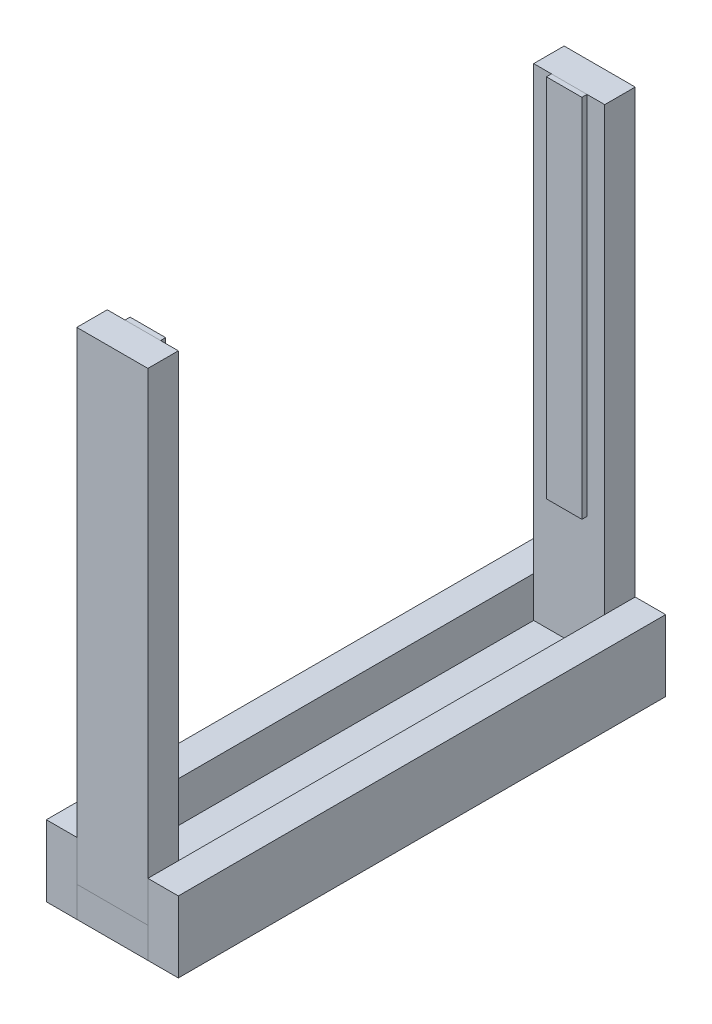
from build123d import *

# Parameters (mm, degrees)
SKETCH1_W             = 88.9
SKETCH1_H             = 609.6
BASE_BOARD_DEPTH      = 38.1
SKETCH2_W             = 88.9
SKETCH2_H             = 38.1
VERTICAL_BOARD_DEPTH  = 603.25
SKETCH3_W             = 609.6
SKETCH3_H             = 88.9
LATERAL_SUPPORT_DEPTH = 38.1
SKETCH4_W             = 44.45
SKETCH4_H             = 457.2
DRAWER_SLIDE_DEPTH    = 6.35


with BuildPart() as part:
    # Sketch1 → Base Board (new body)
    with BuildSketch(Plane(origin=(0, 0, 0), x_dir=(1, 0, 0), z_dir=(0, 1, 0))):
        Rectangle(SKETCH1_W, SKETCH1_H)
    extrude(amount=BASE_BOARD_DEPTH)


with BuildPart() as body_2:
    # Sketch2 → Vertical Board (new body)
    with BuildSketch(Plane(origin=(0, 38.1, 0), x_dir=(1, 0, 0), z_dir=(0, 1, 0))):
        with Locations((0, -285.75)):
            Rectangle(SKETCH2_W, SKETCH2_H)
    extrude(amount=VERTICAL_BOARD_DEPTH)


with BuildPart() as body_3:
    # Vertical Board Mirror: mirrored copy
    add(body_2.part.mirror(Plane.XY))


with BuildPart() as body_4:
    # Sketch3 → Lateral Support (new body)
    with BuildSketch(Plane(origin=(44.45, 0, 0), x_dir=(0, 0, -1), z_dir=(1, 0, 0))):
        with Locations((0, 44.45)):
            Rectangle(SKETCH3_W, SKETCH3_H)
    extrude(amount=LATERAL_SUPPORT_DEPTH)


with BuildPart() as body_5:
    # Lateral Support Mirror: mirrored copy
    add(body_4.part.mirror(Plane(origin=(0, 0, 0), x_dir=(0, 0, 1), z_dir=(1, 0, 0))))


with BuildPart() as body_6:
    # Sketch4 → Drawer Slide (new body)
    with BuildSketch(Plane(origin=(0, 0, 266.7), x_dir=(-1, 0, 0), z_dir=(0, 0, -1))):
        with Locations((0, 412.75)):
            Rectangle(SKETCH4_W, SKETCH4_H)
    extrude(amount=DRAWER_SLIDE_DEPTH)


with BuildPart() as body_7:
    # Mirror5: mirrored copy
    add(body_6.part.mirror(Plane.XY))


solid = Compound([part.part, body_2.part, body_3.part, body_4.part, body_5.part, body_6.part, body_7.part])
